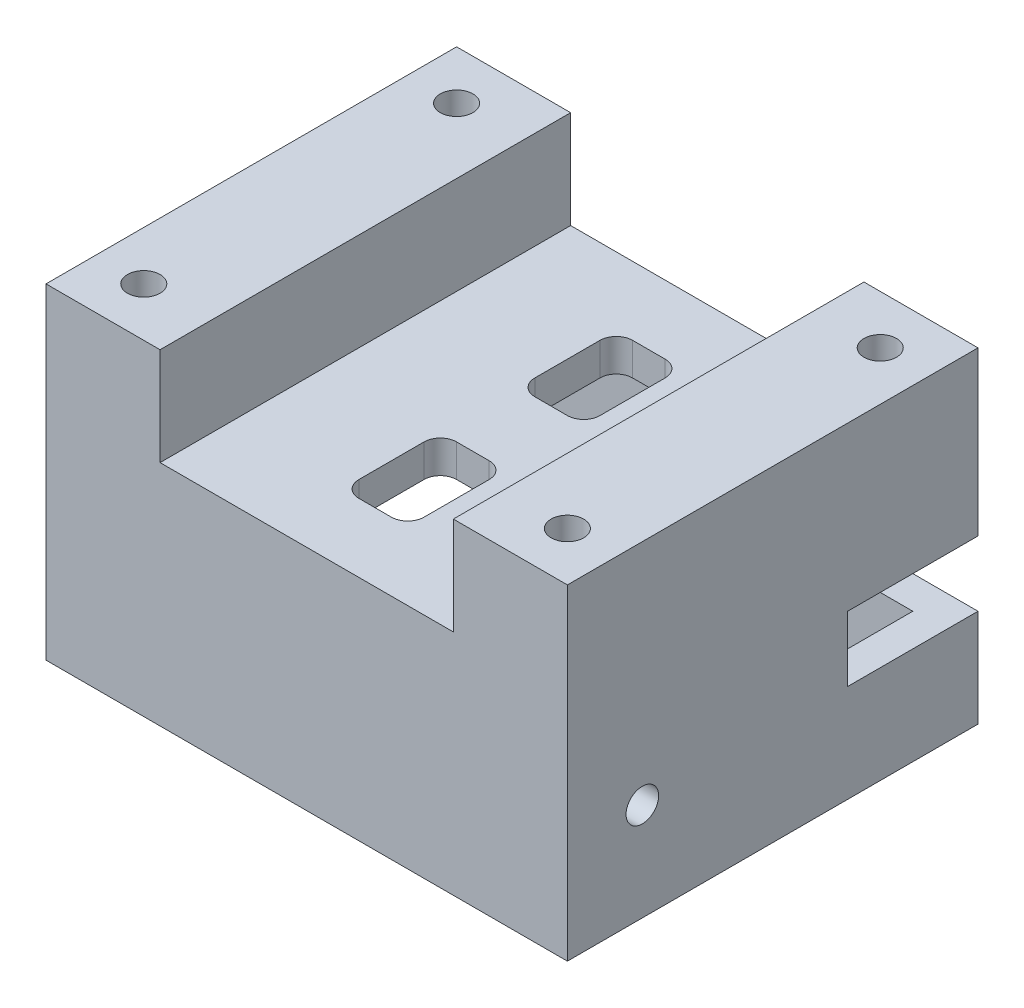
from build123d import *

# Parameters (mm, degrees)
SKETCH1_W           = 160
SKETCH1_H           = 100
BOSS_EXTRUDE1_DEPTH = 126
SKETCH2_W           = 90
SKETCH2_H           = 60
CUT_EXTRUDE1_DEPTH  = 126
SKETCH3_R           = 5
CUT_EXTRUDE2_DEPTH  = 40
SHELL1_START        = -50
SHELL1_DEPTH        = 60
SHELL1_2_DEPTH      = 50
SHELL1_START_2      = 10
SHELL1_3_DEPTH      = 30
SKETCH4_W           = 20
SKETCH4_H           = 30
CUT_EXTRUDE3_DEPTH  = 180.655225362
FILLET1_R           = 5
SKETCH5_W           = 30
SKETCH5_H           = 20
CUT_EXTRUDE4_DEPTH  = 40
SKETCH6_W           = 110
SKETCH6_H           = 106
CUT_EXTRUDE5_DEPTH  = 10
SKETCH7_W           = 15
SKETCH7_H           = 73.639320226
CUT_EXTRUDE6_DEPTH  = 40
SKETCH8_R           = 5
CUT_EXTRUDE7_DEPTH  = 210.704554075


# Read off the part's stored shape, not the designer's step: Shell1
with BuildPart() as part:
    # Sketch1 → Boss-Extrude1 (new body)
    with BuildSketch(Plane.XY):
        Rectangle(SKETCH1_W, SKETCH1_H)
    extrude(amount=-BOSS_EXTRUDE1_DEPTH)

    # Sketch2 → Cut-Extrude1 (cut)
    with BuildSketch(Plane.XY):
        with Locations((0, 50)):
            Rectangle(SKETCH2_W, SKETCH2_H)
    extrude(amount=-CUT_EXTRUDE1_DEPTH, mode=Mode.SUBTRACT)

    # Sketch3 → Cut-Extrude2 (cut)
    with BuildSketch(Plane(origin=(0, 50, 0), x_dir=(1, 0, 0), z_dir=(0, 1, 0))):
        with Locations(Location((-65, 111, 0), (0, 0, 270))):
            Circle(SKETCH3_R)
        with Locations(Location((65, 111, 0), (0, 0, 90))):
            Circle(SKETCH3_R)
        with Locations(Location((65, 15, 0), (0, 0, 270))):
            Circle(SKETCH3_R)
        with Locations(Location((-65, 15, 0), (0, 0, 90))):
            Circle(SKETCH3_R)
    extrude(amount=-CUT_EXTRUDE2_DEPTH, mode=Mode.SUBTRACT)

    # Shell1 outline → Shell1 (cut)
    with BuildSketch(Plane(origin=(0, 0, 0), x_dir=(1, 0, 0), z_dir=(0, 1, 0)).offset(SHELL1_START)):
        with BuildLine():
            Line((70, 29.142135624), (70, 96.857864376))
            ThreePointArc((70, 96.857864376), (54.393398282, 100.393398282), (50.857864376, 116))
            Line((50.857864376, 116), (-50.857864376, 116))
            ThreePointArc((-50.857864376, 116), (-54.393398282, 100.393398282), (-70, 96.857864376))
            Line((-70, 96.857864376), (-70, 29.142135624))
            ThreePointArc((-70, 29.142135624), (-54.393398282, 25.606601718), (-50.857864376, 10))
            Line((-50.857864376, 10), (50.857864376, 10))
            ThreePointArc((50.857864376, 10), (54.393398282, 25.606601718), (70, 29.142135624))
        make_face()
    extrude(amount=SHELL1_DEPTH, mode=Mode.SUBTRACT)

    # Shell1 2 outline → Shell1 2 (cut)
    with BuildSketch(Plane(origin=(0, 0, 0), x_dir=(1, 0, 0), z_dir=(0, 1, 0)).offset(SHELL1_START)):
        with BuildLine():
            Line((50.857864376, 10), (70, 10))
            Line((70, 10), (70, 29.142135624))
            ThreePointArc((70, 29.142135624), (54.393398282, 25.606601718), (50.857864376, 10))
        make_face()
        with BuildLine():
            ThreePointArc((50.857864376, 116), (54.393398282, 100.393398282), (70, 96.857864376))
            Line((70, 96.857864376), (70, 116))
            Line((70, 116), (50.857864376, 116))
        make_face()
        with BuildLine():
            Line((-70, 10), (-50.857864376, 10))
            ThreePointArc((-50.857864376, 10), (-54.393398282, 25.606601718), (-70, 29.142135624))
            Line((-70, 29.142135624), (-70, 10))
        make_face()
        with BuildLine():
            ThreePointArc((-70, 96.857864376), (-54.393398282, 100.393398282), (-50.857864376, 116))
            Line((-50.857864376, 116), (-70, 116))
            Line((-70, 116), (-70, 96.857864376))
        make_face()
    extrude(amount=SHELL1_2_DEPTH, mode=Mode.SUBTRACT)

    # Shell1 3 outline → Shell1 3 (cut)
    with BuildSketch(Plane(origin=(0, 0, 0), x_dir=(1, 0, 0), z_dir=(0, 1, 0)).offset(SHELL1_START_2)):
        with BuildLine():
            ThreePointArc((55, 26.180339887), (62.094305849, 29.715873794), (70, 29.142135624))
            Line((70, 29.142135624), (70, 96.857864376))
            ThreePointArc((70, 96.857864376), (62.094305849, 96.284126206), (55, 99.819660113))
            Line((55, 99.819660113), (55, 26.180339887))
        make_face()
        with BuildLine():
            ThreePointArc((-70, 29.142135624), (-62.094305849, 29.715873794), (-55, 26.180339887))
            Line((-55, 26.180339887), (-55, 99.819660113))
            ThreePointArc((-55, 99.819660113), (-62.094305849, 96.284126206), (-70, 96.857864376))
            Line((-70, 96.857864376), (-70, 29.142135624))
        make_face()
    extrude(amount=SHELL1_3_DEPTH, mode=Mode.SUBTRACT)

    # Sketch4 → Cut-Extrude3 (cut, through all)
    with BuildSketch(Plane(origin=(0, 50, 0), x_dir=(1, 0, 0), z_dir=(0, 1, 0))):
        with Locations((0, 90)):
            Rectangle(SKETCH4_W, SKETCH4_H)
        with Locations((0, 36)):
            Rectangle(SKETCH4_W, SKETCH4_H)
    extrude(amount=-CUT_EXTRUDE3_DEPTH, mode=Mode.SUBTRACT)

    # Fillet1
    fillet1_edges = [part.edges().sort_by_distance(p)[0] for p in [
        (-10, 15, -21),
        (-10, 15, -51),
        (10, 15, -51),
        (10, 15, -21),
        (10, 15, -105),
        (10, 15, -75),
        (-10, 15, -75),
        (-10, 15, -105),
    ]]
    fillet(fillet1_edges, radius=FILLET1_R)

    # Sketch5 → Cut-Extrude4 (cut)
    with BuildSketch(Plane(origin=(0, 0, -126), x_dir=(-1, 0, 0), z_dir=(0, 0, -1))):
        with Locations((-65, -10)):
            Rectangle(SKETCH5_W, SKETCH5_H)
        with Locations((65, -10)):
            Rectangle(SKETCH5_W, SKETCH5_H)
    extrude(amount=-CUT_EXTRUDE4_DEPTH, mode=Mode.SUBTRACT)

    # Sketch6 → Cut-Extrude5 (cut)
    with BuildSketch(Plane.XZ.offset(-10)):
        with Locations((0, -63)):
            Rectangle(SKETCH6_W, SKETCH6_H)
    extrude(amount=CUT_EXTRUDE5_DEPTH, mode=Mode.SUBTRACT)

    # Sketch7 → Cut-Extrude6 (cut)
    with BuildSketch(Plane.XZ.offset(-40)):
        with Locations((-62.5, -63)):
            Rectangle(SKETCH7_W, SKETCH7_H)
    cut_extrude6 = extrude(amount=CUT_EXTRUDE6_DEPTH, mode=Mode.SUBTRACT)

    # Mirror1: Cut-Extrude6 across plane
    add(cut_extrude6.mirror(Plane(origin=(0, 0, 0), x_dir=(0, 0, 1), z_dir=(1, 0, 0))), mode=Mode.SUBTRACT)

    # Sketch8 → Cut-Extrude7 (cut, through all)
    with BuildSketch(Plane(origin=(80, 0, 0), x_dir=(0, 0, -1), z_dir=(1, 0, 0))):
        with Locations((23, -20)):
            Circle(SKETCH8_R)
    extrude(amount=-CUT_EXTRUDE7_DEPTH, mode=Mode.SUBTRACT)


solid = part.part
